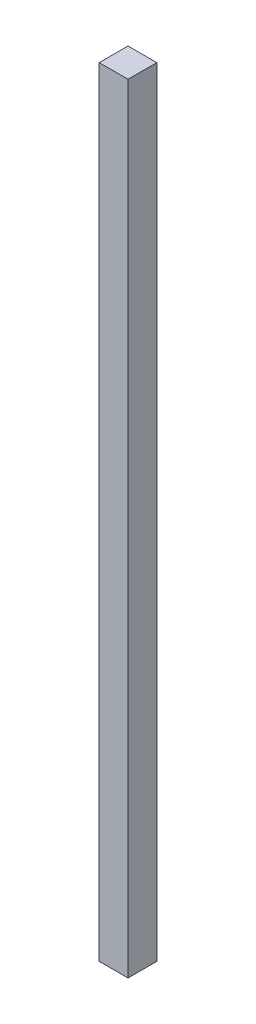
from build123d import *

# Parameters (mm, degrees)
SKETCH1_W           = 37
SKETCH1_H           = 37
BOSS_EXTRUDE1_DEPTH = 1000


with BuildPart() as part:
    # Sketch1 → Boss-Extrude1 (new body)
    with BuildSketch(Plane(origin=(0, 0, 0), x_dir=(1, 0, 0), z_dir=(0, 1, 0))):
        Rectangle(SKETCH1_W, SKETCH1_H)
    extrude(amount=BOSS_EXTRUDE1_DEPTH)


solid = part.part
